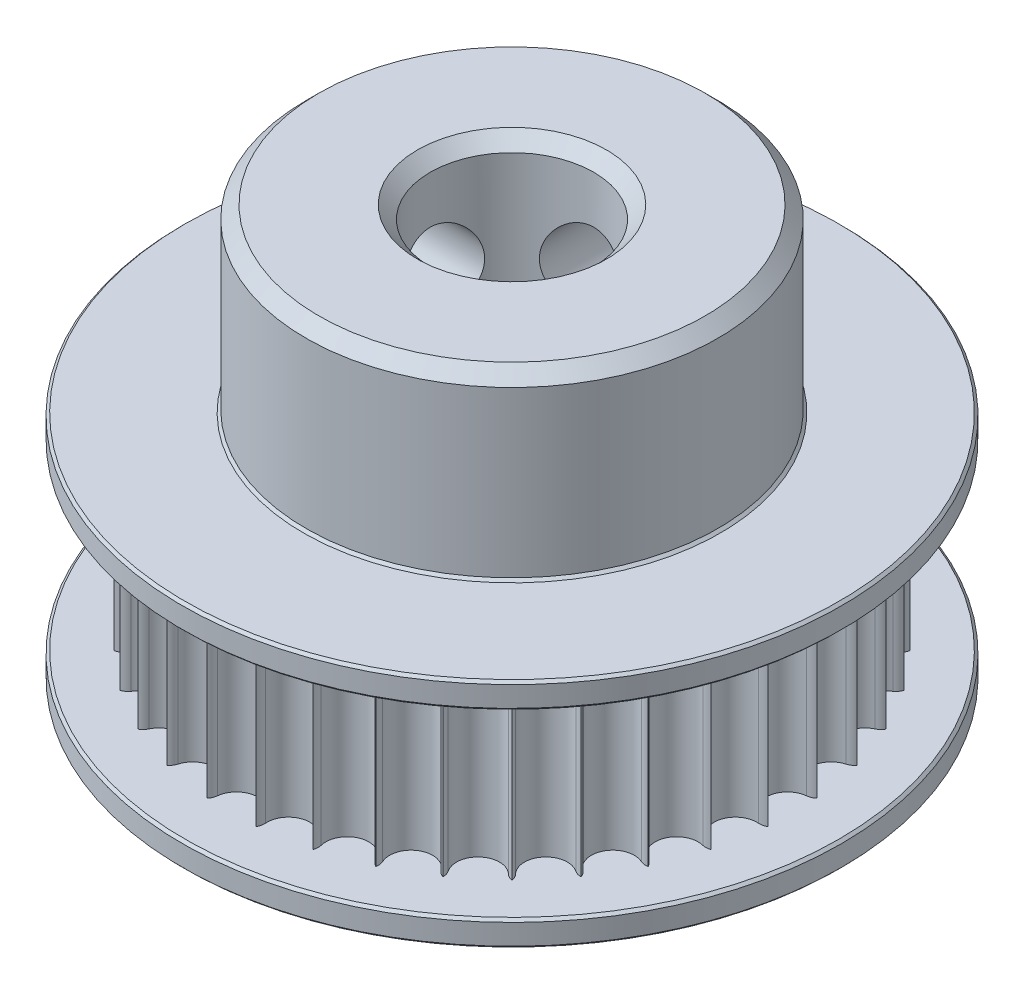
from build123d import *

# Parameters (mm, degrees)
CUT_EXTRUDE1_DEPTH      = 7
CIRPATTERN1_COUNT       = 36
CUT_EXTRUDE2_REACH      = 21.998
CUT_EXTRUDE2_END_RADIUS = 8
SKETCH3_R               = 1.65
CUT_EXTRUDE3_REACH      = 21.998
CUT_EXTRUDE3_END_RADIUS = 8
SKETCH4_R               = 1.65
CHAMFER1_SIZE           = 1
CHAMFER2_SIZE           = 0.5
CHAMFER3_SIZE           = 0.1


with BuildPart() as part:
    # Skica2 → Revolute (revolve)
    with BuildSketch(Plane.XY):
        Polygon((8, 8.5), (3.175, 8.5), (3.175, -8.5), (6.11, -8.5), (6.11, -7.5), (12.8, -7.5), (12.8, -6.5), (11.15, -6.5), (11.15, 0.5), (12.8, 0.5), (12.8, 1.5), (8, 1.5), align=None)
    revolve(axis=Axis((0, -8.5, 0), (0, 1, 0)))

    # Sketch2 → Cut-Extrude1 (cut)
    with BuildSketch(Plane.XZ.offset(-0.5)):
        with BuildLine():
            ThreePointArc((-0.831661365, 10.617478014), (0, 9.866329289), (0.831661365, 10.617478014))
            ThreePointArc((0.831661365, 10.617478014), (1.017799005, 10.958027157), (1.391478752, 11.062833583))
            ThreePointArc((1.391478752, 11.062833583), (1.776250939, 11.007607942), (2.1588643, 10.939003837))
            ThreePointArc((2.1588643, 10.939003837), (1.553174348, 12.383882602), (0, 12.589271032))
            ThreePointArc((0, 12.589271032), (-1.553174348, 12.383882602), (-2.1588643, 10.939003837))
            ThreePointArc((-2.1588643, 10.939003837), (-1.776250939, 11.007607942), (-1.391478752, 11.062833583))
            ThreePointArc((-1.391478752, 11.062833583), (-1.017799005, 10.958027157), (-0.831661365, 10.617478014))
        make_face()
    cut_extrude1 = extrude(amount=CUT_EXTRUDE1_DEPTH, mode=Mode.SUBTRACT)

    # CirPattern1: Cut-Extrude1 ×36 about axis
    cirpattern1_axis = Axis((0, 0, 0), (0, 1, 0))
    for i in range(1, CIRPATTERN1_COUNT):
        add(cut_extrude1.rotate(cirpattern1_axis, i * 360 / CIRPATTERN1_COUNT), mode=Mode.SUBTRACT)

    # Cut-Extrude2: up to this cylinder (the profile starts inside it)
    cut_extrude2_end = Plane(origin=(0, 4.5, 0), z_dir=(0, -1, 0)) * Cylinder(CUT_EXTRUDE2_END_RADIUS, 60.996, mode=Mode.PRIVATE)
    # Sketch3 → Cut-Extrude2 (cut, up to the surface)
    with BuildSketch(Plane(origin=(0, 0, 0), x_dir=(0, 0, -1), z_dir=(1, 0, 0)), mode=Mode.PRIVATE) as cut_extrude2_sk1:
        with Locations((0, 4.5)):
            Circle(SKETCH3_R)
    cut_extrude2_tool1 = extrude(cut_extrude2_sk1.sketch, amount=-CUT_EXTRUDE2_REACH, mode=Mode.PRIVATE) & cut_extrude2_end
    add(cut_extrude2_tool1.solids().sort_by_distance((0, 4.5, 0))[0], mode=Mode.SUBTRACT)

    # Cut-Extrude3: up to this cylinder (the profile starts inside it)
    cut_extrude3_end = Plane(origin=(0, 4.5, 0), z_dir=(0, -1, 0)) * Cylinder(CUT_EXTRUDE3_END_RADIUS, 60.996, mode=Mode.PRIVATE)
    # Sketch4 → Cut-Extrude3 (cut, up to the surface)
    with BuildSketch(Plane.XY, mode=Mode.PRIVATE) as cut_extrude3_sk1:
        with Locations((0, 4.5)):
            Circle(SKETCH4_R)
    cut_extrude3_tool1 = extrude(cut_extrude3_sk1.sketch, amount=-CUT_EXTRUDE3_REACH, mode=Mode.PRIVATE) & cut_extrude3_end
    add(cut_extrude3_tool1.solids().sort_by_distance((0, 4.5, 0))[0], mode=Mode.SUBTRACT)

    # Chamfer1
    chamfer1_edges = [part.edges().sort_by_distance(p)[0] for p in [
        (-6.11, -7.5, 0),
    ]]
    chamfer(chamfer1_edges, length=CHAMFER1_SIZE - 0.0001)  # a hair under: the kernel refuses the full size

    # Chamfer2
    chamfer2_edges = [part.edges().sort_by_distance(p)[0] for p in [
        (-3.175, 8.5, 0),
        (-8, 8.5, 0),
    ]]
    chamfer(chamfer2_edges, length=CHAMFER2_SIZE)

    # Chamfer3
    chamfer3_edges = [part.edges().sort_by_distance(p)[0] for p in [
        (-12.8, 0.5, 0),
        (-12.8, -6.5, 0),
        (-12.8, -7.5, 0),
        (-8, 1.5, 0),
        (-12.8, 1.5, 0),
    ]]
    chamfer(chamfer3_edges, length=CHAMFER3_SIZE)


solid = part.part
